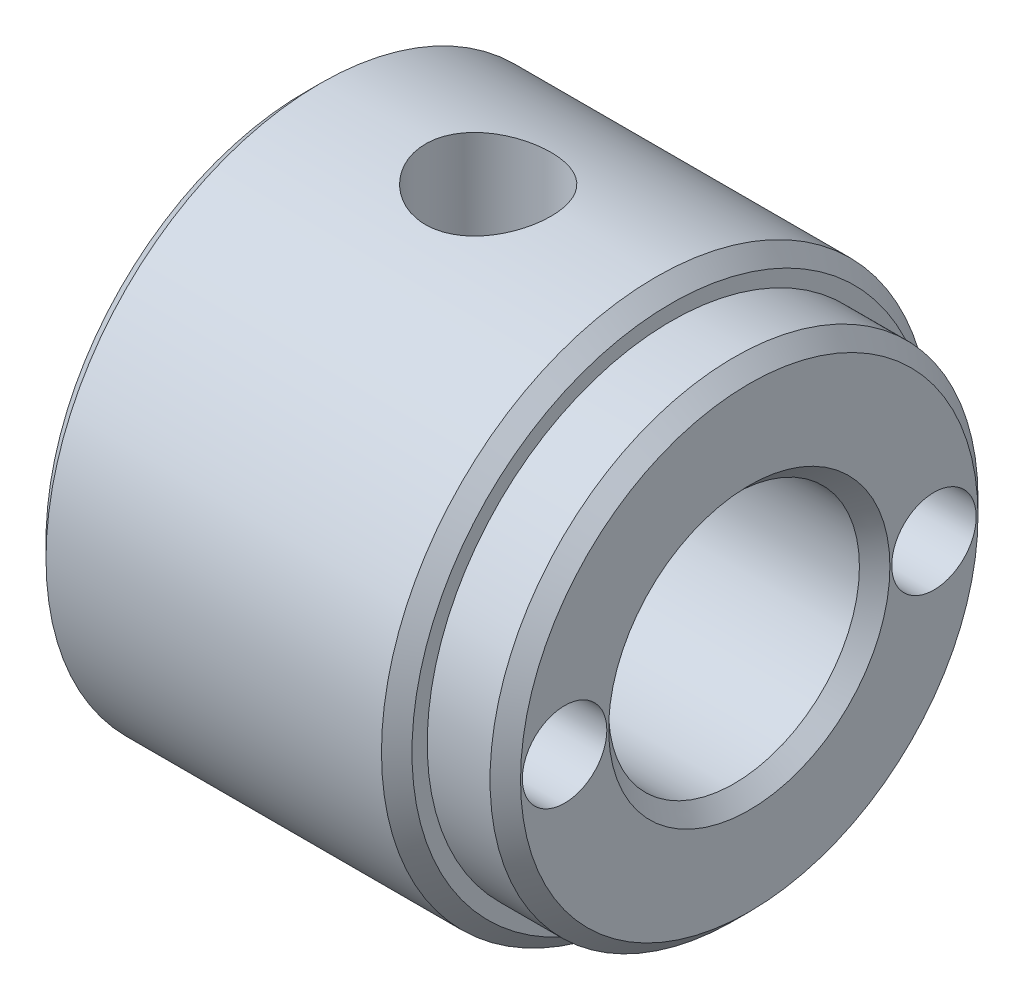
from build123d import *

# Parameters (mm, degrees)
SKETCH1_R                                 = 6.35
SKETCH1_R_2                               = 1.099999959
SKETCH1_R_3                               = 3.2639
INNER_SIDE_EXTRUDE_DEPTH                  = 2.032
OUTER_START                               = -9.525
SKETCH1_3_R                               = 7.14375
SKETCH1_3_R_2                             = 1.099999959
SKETCH1_3_R_3                             = 3.2639
OUTER_SIDE_EXTRUDE_DEPTH                  = 9.525
CUT_EXTRUDE1_DEPTH                        = 14.8849542
CUT_EXTRUDE1_DEPTH_BACK                   = 14.8849542
SKETCH2_R                                 = 1.63195
CHAMFER_SO_STEVE_DOESN_T_CUT_HIMSELF_SIZE = 0.396875


with BuildPart() as part:
    # Sketch1 → Inner Side Extrude (new body)
    with BuildSketch(Plane(origin=(0, 0, 0), x_dir=(0, 0, -1), z_dir=(1, 0, 0))):
        Circle(SKETCH1_R)
        with Locations((-4.80695, 0)):
            Circle(SKETCH1_R_2, mode=Mode.SUBTRACT)
        Circle(SKETCH1_R_3, mode=Mode.SUBTRACT)
        with Locations((4.80695, 0)):
            Circle(SKETCH1_R_2, mode=Mode.SUBTRACT)
    extrude(amount=INNER_SIDE_EXTRUDE_DEPTH)

    # Sketch1<3> → Outer Side Extrude (add)
    with BuildSketch(Plane(origin=(0, 0, 0), x_dir=(0, 0, -1), z_dir=(1, 0, 0)).offset(OUTER_START)):
        Circle(SKETCH1_3_R)
        with Locations((-4.80695, 0)):
            Circle(SKETCH1_3_R_2, mode=Mode.SUBTRACT)
        Circle(SKETCH1_3_R_3, mode=Mode.SUBTRACT)
        with Locations((4.80695, 0)):
            Circle(SKETCH1_3_R_2, mode=Mode.SUBTRACT)
    extrude(amount=OUTER_SIDE_EXTRUDE_DEPTH)

    # Sketch2 → Cut-Extrude1 (cut, two sides: drawn at the far end of the back side and taken through both)
    with BuildSketch(Plane(origin=(0, 0, 0), x_dir=(1, 0, 0), z_dir=(0, 1, 0)).offset(-CUT_EXTRUDE1_DEPTH_BACK)):
        with Locations((-4.7625, 0)):
            Circle(SKETCH2_R)
    extrude(amount=CUT_EXTRUDE1_DEPTH + CUT_EXTRUDE1_DEPTH_BACK, mode=Mode.SUBTRACT)

    # Chamfer so Steve Doesn't cut himself
    chamfer_so_steve_doesn_t_cut_himself_edges = [part.edges().sort_by_distance(p)[0] for p in [
        (-9.525, 0, 3.2639),
        (2.032, 0, 3.2639),
        (2.032, 0, 6.35),
        (-9.525, 0, 7.14375),
        (0, 0, 7.14375),
    ]]
    chamfer(chamfer_so_steve_doesn_t_cut_himself_edges, length=CHAMFER_SO_STEVE_DOESN_T_CUT_HIMSELF_SIZE)


solid = part.part
